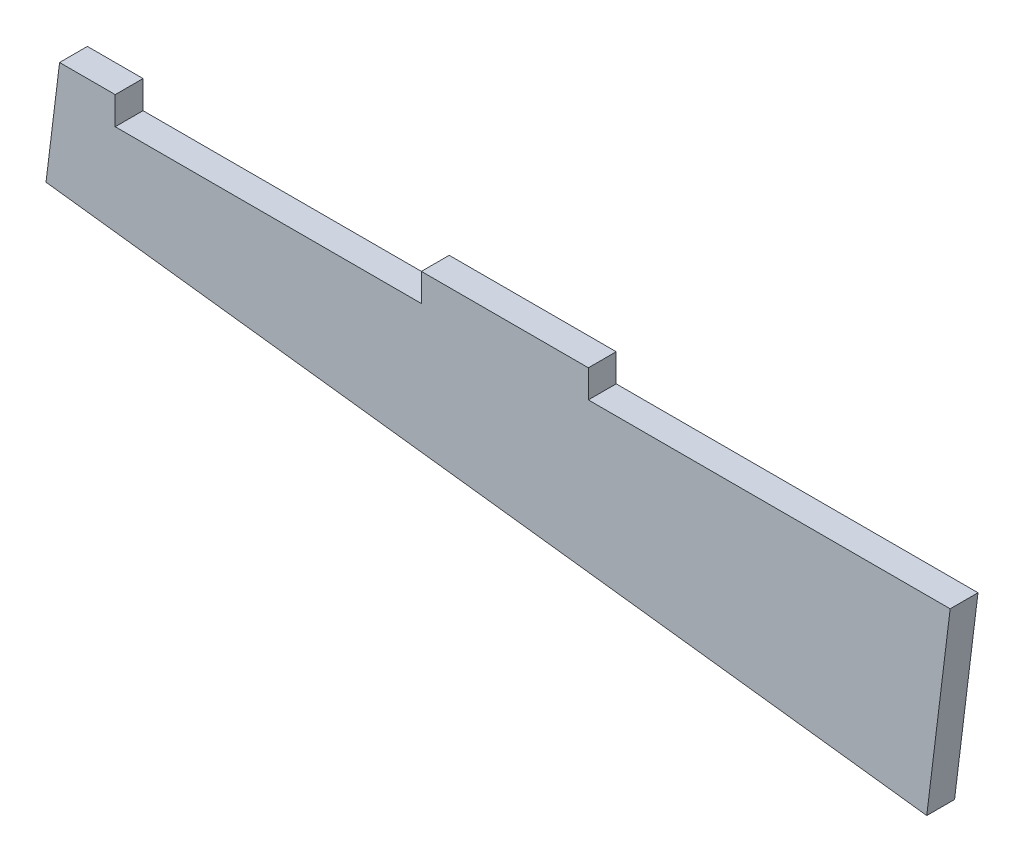
from build123d import *

# Parameters (mm, degrees)
BOSS_EXTRUDE1_DEPTH = 6.35


with BuildPart() as part:
    # Sketch1 → Boss-Extrude1 (new body)
    with BuildSketch(Plane.XY):
        Polygon((-195.316766477, -62.659206724), (-182.616766477, -62.659206724), (-182.616766477, -69.009206724), (-112.766766477, -69.009206724), (-112.766766477, -62.659206724), (-74.666766477, -62.659206724), (-74.666766477, -69.009206724), (7.883233523, -69.009206724), (2.537900009, -112.543454638), (-198.412247799, -87.869878976), align=None)
    extrude(amount=-BOSS_EXTRUDE1_DEPTH)


solid = part.part
